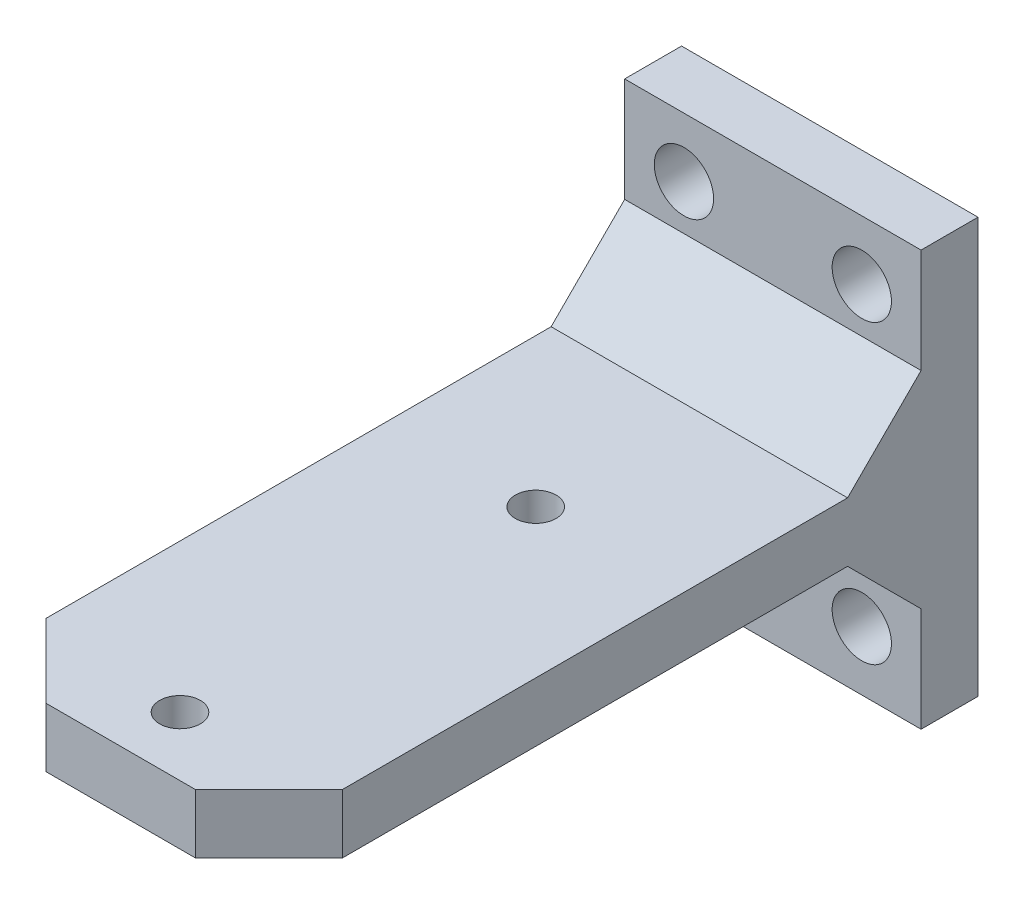
from build123d import *

# Parameters (mm, degrees)
BOSS_EXTRUDE1_DEPTH = 31.75
SKETCH2_R           = 3.175
CUT_EXTRUDE1_DEPTH  = 19.05
CHAMFER1_SIZE       = 7.874
SKETCH3_R           = 2.1828125
CUT_EXTRUDE2_DEPTH  = 19.05
CHAMFER2_SIZE       = 7.874
CHAMFER3_SIZE       = 0.254


with BuildPart() as part:
    # Sketch1 → Boss-Extrude1 (new body)
    with BuildSketch(Plane(origin=(0, 0, 0), x_dir=(0, 0, -1), z_dir=(1, 0, 0))):
        Polygon((0, 0), (0, 44.45), (-6.35, 44.45), (-6.35, 25.4), (-76.2, 25.4), (-76.2, 19.05), (-6.35, 19.05), (-6.35, 0), align=None)
    extrude(amount=BOSS_EXTRUDE1_DEPTH)

    # Sketch2 → Cut-Extrude1 (cut)
    with BuildSketch(Plane.XY.offset(6.35)):
        with Locations((6.35, 38.1)):
            Circle(SKETCH2_R)
        with Locations((25.4, 38.1)):
            Circle(SKETCH2_R)
        with Locations((6.35, 6.35)):
            Circle(SKETCH2_R)
        with Locations((25.4, 6.35)):
            Circle(SKETCH2_R)
    extrude(amount=-CUT_EXTRUDE1_DEPTH, mode=Mode.SUBTRACT)

    # Chamfer1
    chamfer1_edges = [part.edges().sort_by_distance(p)[0] for p in [
        (15.875, 19.05, 6.35),
        (15.875, 25.4, 6.35),
    ]]
    chamfer(chamfer1_edges, length=CHAMFER1_SIZE)

    # Sketch3 → Cut-Extrude2 (cut)
    with BuildSketch(Plane(origin=(0, 25.4, 0), x_dir=(1, 0, 0), z_dir=(0, 1, 0))):
        with Locations((15.875, -69.85)):
            Circle(SKETCH3_R)
        with Locations((15.875, -31.75)):
            Circle(SKETCH3_R)
    extrude(amount=-CUT_EXTRUDE2_DEPTH, mode=Mode.SUBTRACT)

    # Chamfer2
    chamfer2_edges = [part.edges().sort_by_distance(p)[0] for p in [
        (31.75, 22.225, 76.2),
        (0, 22.225, 76.2),
    ]]
    chamfer(chamfer2_edges, length=CHAMFER2_SIZE)

    # Chamfer3
    chamfer3_edges = [part.edges().sort_by_distance(p)[0] for p in [
        (15.875, 0, 0),
        (31.75, 22.225, 0),
        (15.875, 44.45, 0),
        (0, 22.225, 0),
        (3.175, 38.1, 0),
        (22.225, 6.35, 0),
        (3.175, 6.35, 0),
        (22.225, 38.1, 0),
    ]]
    chamfer(chamfer3_edges, length=CHAMFER3_SIZE)


solid = part.part
